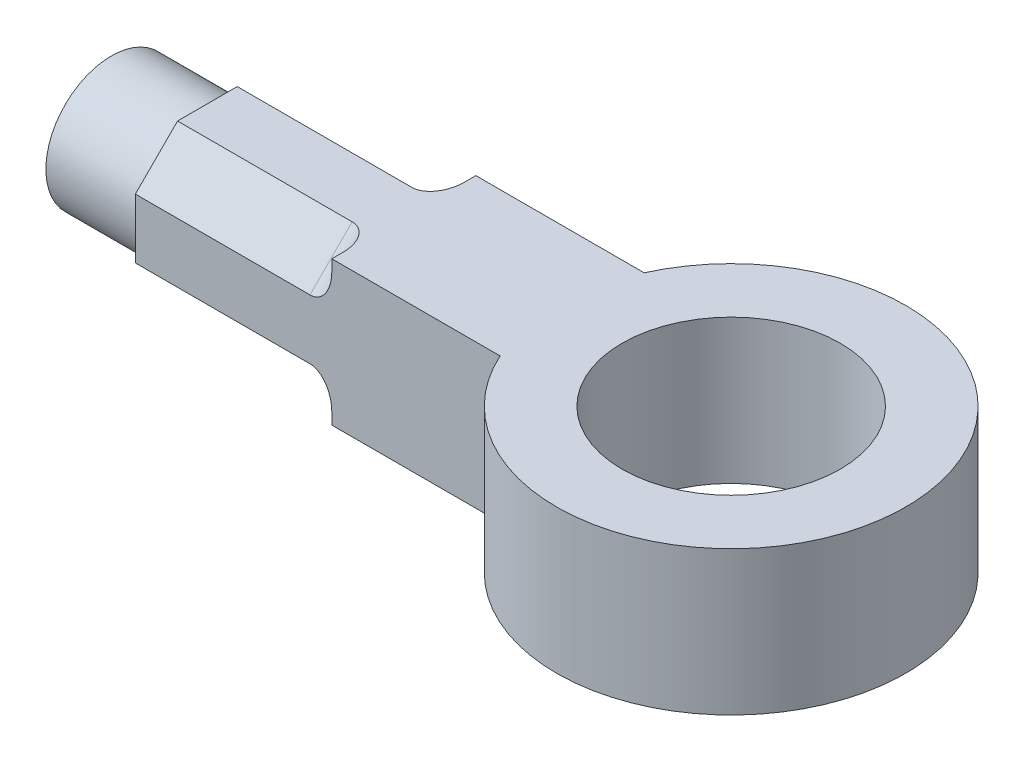
from build123d import *

# Parameters (mm, degrees)
SKETCH1_R                = 40
SKETCH1_R_2              = 25
BOSS_EXTRUDE1_DEPTH      = 18
BOSS_EXTRUDE2_DEPTH      = 45
SKETCH3_R                = 15
BOSS_EXTRUDE3_DEPTH      = 22
BOSS_EXTRUDE4_REACH      = 125.081
SKETCH4_W                = 33
SKETCH4_H                = 33
FILLET1_R                = 5
FILLET7_R                = 1.5
SCALA2_SCALE             = 0.1
SCHIZZO3_W               = 13.390862708
SCHIZZO3_H               = 12.193146248
TAGLIO_ESTRUSIONE3_DEPTH = 0.15
SCHIZZO4_W               = 17.573052966
SCHIZZO4_H               = 12.055703376
TAGLIO_ESTRUSIONE4_DEPTH = 0.15


with BuildPart() as part:
    # Sketch1 → Boss-Extrude1 (new, symmetric)
    with BuildSketch(Plane(origin=(0, 0, 0), x_dir=(1, 0, 0), z_dir=(0, 1, 0))):
        with Locations(Location((0, 0, 0), (0, 0, 270))):
            Circle(SKETCH1_R)
        with Locations(Location((0, 0, 0), (0, 0, 270))):
            Circle(SKETCH1_R_2, mode=Mode.SUBTRACT)
    extrude(amount=BOSS_EXTRUDE1_DEPTH, both=True)

    # Sketch4 → Boss-Extrude4 (add, up to next)
    with BuildSketch(Plane(origin=(-75, 0, 0), x_dir=(0, 0, -1), z_dir=(1, 0, 0)), mode=Mode.PRIVATE) as boss_extrude4_sk1:
        Rectangle(SKETCH4_W, SKETCH4_H)
    boss_extrude4_tool1 = extrude(boss_extrude4_sk1.sketch, amount=BOSS_EXTRUDE4_REACH, mode=Mode.PRIVATE) - part.part


with BuildPart() as body_2:
    # Sketch2 → Boss-Extrude2 (new body)
    with BuildSketch(Plane(origin=(-120, 0, 0), x_dir=(0, 0, -1), z_dir=(1, 0, 0))):
        Polygon((-16.5, 6.834523779), (-16.5, -6.834523779), (-6.834523779, -16.5), (6.834523779, -16.5), (16.5, -6.834523779), (16.5, 6.834523779), (6.834523779, 16.5), (-6.834523779, 16.5), align=None)
    extrude(amount=BOSS_EXTRUDE2_DEPTH)

    # Sketch3 → Boss-Extrude3 (add)
    with BuildSketch(Plane(origin=(-120, 0, 0), x_dir=(0, 0, -1), z_dir=(1, 0, 0))):
        Circle(SKETCH3_R)
    extrude(amount=-BOSS_EXTRUDE3_DEPTH)


with BuildPart() as part_1:
    add(part.part)

    add(body_2.part)  # Boss-Extrude4 merges body 2
    add(boss_extrude4_tool1.solids().sort_by_distance((-75, 0, 0))[0])

    # Fillet1
    fillet1_edges = [part_1.edges().sort_by_distance(p)[0] for p in [
        (-75, 11.66726189, 11.66726189),
        (-75, -11.66726189, 11.66726189),
        (-75, -11.66726189, -11.66726189),
        (-75, 11.66726189, -11.66726189),
    ]]
    fillet(fillet1_edges, radius=FILLET1_R)

    # Fillet7
    fillet7_edges = [part_1.edges().sort_by_distance(p)[0] for p in [
        (-40, -16.5, 0),
        (-40, 16.5, 0),
    ]]
    fillet(fillet7_edges, radius=FILLET7_R - 0.0001)  # a hair under: the kernel refuses the full size


with BuildPart() as part_2:
    # Scala2: scaled about (-40.064009794, 0, -1e-09)
    add(part_1.part.scale(SCALA2_SCALE).moved(Location((-36.057608815, 0, -1e-09))))

    # Schizzo3 → Taglio-Estrusione3 (cut)
    with BuildSketch(Plane(origin=(0, 1.8, 0), x_dir=(1, 0, 0), z_dir=(0, 1, 0))):
        with Locations((-35.542120141, -0.94246541)):
            Rectangle(SCHIZZO3_W, SCHIZZO3_H)
    extrude(amount=-TAGLIO_ESTRUSIONE3_DEPTH, mode=Mode.SUBTRACT)

    # Schizzo4 → Taglio-Estrusione4 (cut)
    with BuildSketch(Plane.XZ.offset(1.8)):
        with Locations((-38.634584769, -0.834474582)):
            Rectangle(SCHIZZO4_W, SCHIZZO4_H)
    extrude(amount=-TAGLIO_ESTRUSIONE4_DEPTH, mode=Mode.SUBTRACT)


solid = part_2.part
